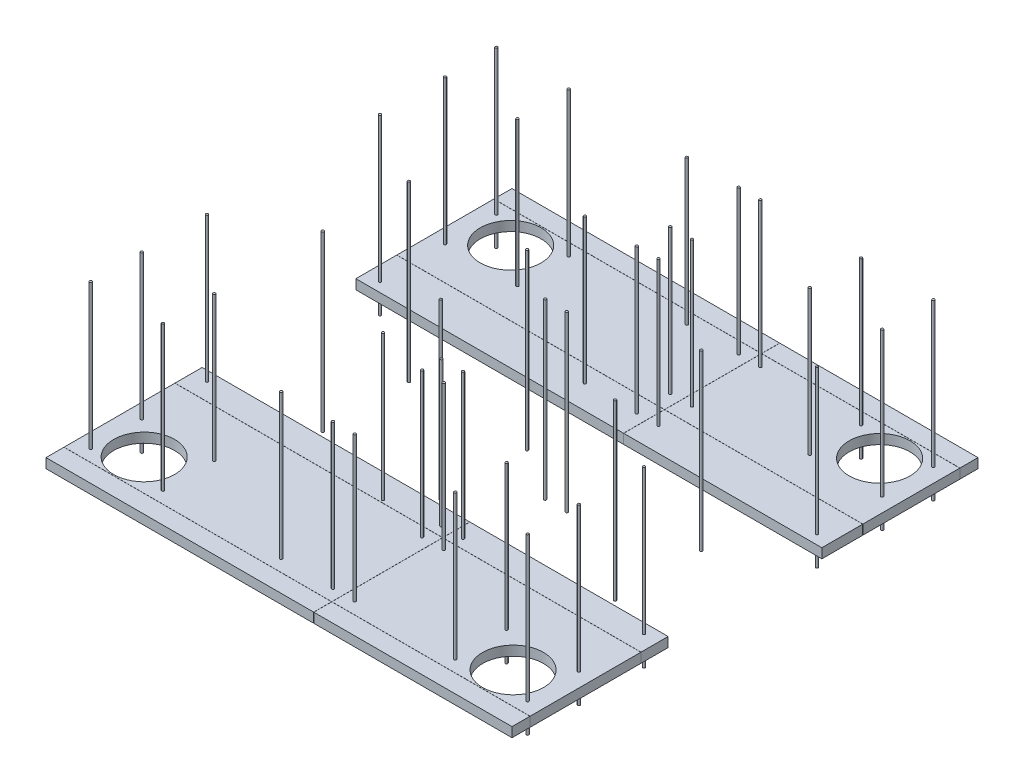
from build123d import *

# Parameters (mm, degrees)
SKETCH1_W                          = 4908.55
SKETCH1_H                          = 4908.55
BOSS_EXTRUDE1_DEPTH                = 101.6
SKETCH2_W                          = 4908.55
SKETCH2_H                          = 1619.25
CUT_EXTRUDE1_DEPTH                 = 3473.355700566
SKETCH4_W                          = 4908.55
SKETCH4_H                          = 1.27
CUT_EXTRUDE_THIN1_DEPTH            = 3473.355700566
CUT_EXTRUDE_THIN2_DEPTH            = 3473.355700566
CUT_EXTRUDE_THIN2_DEPTH_BACK       = 3473.355700566
SKETCH5_W                          = 1.27
SKETCH5_H                          = 4908.55
SKETCH6_R                          = 320.675
DUCT_HOLES_DEPTH                   = 3473.355700566
UNISTRUT_STUD_LAYOUT_DEPTH         = 1524
UNISTRUT_STUD_LAYOUT_DEPTH_BACK    = 304.8
SKETCH7_R                          = 12.7
UNISTRUT_STUD_LAYOUT_2_DEPTH       = 1524
UNISTRUT_STUD_LAYOUT_2_DEPTH_BACK  = 304.8
UNISTRUT_STUD_LAYOUT_3_DEPTH       = 1524
UNISTRUT_STUD_LAYOUT_3_DEPTH_BACK  = 304.8
UNISTRUT_STUD_LAYOUT_4_DEPTH       = 1524
UNISTRUT_STUD_LAYOUT_4_DEPTH_BACK  = 304.8
UNISTRUT_STUD_LAYOUT_5_DEPTH       = 1524
UNISTRUT_STUD_LAYOUT_5_DEPTH_BACK  = 304.8
UNISTRUT_STUD_LAYOUT_6_DEPTH       = 1524
UNISTRUT_STUD_LAYOUT_6_DEPTH_BACK  = 304.8
UNISTRUT_STUD_LAYOUT_7_DEPTH       = 1524
UNISTRUT_STUD_LAYOUT_7_DEPTH_BACK  = 304.8
UNISTRUT_STUD_LAYOUT_8_DEPTH       = 1524
UNISTRUT_STUD_LAYOUT_8_DEPTH_BACK  = 304.8
UNISTRUT_STUD_LAYOUT_9_DEPTH       = 1524
UNISTRUT_STUD_LAYOUT_9_DEPTH_BACK  = 304.8
UNISTRUT_STUD_LAYOUT_10_DEPTH      = 1524
UNISTRUT_STUD_LAYOUT_10_DEPTH_BACK = 304.8
UNISTRUT_STUD_LAYOUT_11_DEPTH      = 1524
UNISTRUT_STUD_LAYOUT_11_DEPTH_BACK = 304.8
UNISTRUT_STUD_LAYOUT_12_DEPTH      = 1524
UNISTRUT_STUD_LAYOUT_12_DEPTH_BACK = 304.8
UNISTRUT_STUD_LAYOUT_13_DEPTH      = 1524
UNISTRUT_STUD_LAYOUT_13_DEPTH_BACK = 304.8
UNISTRUT_STUD_LAYOUT_14_DEPTH      = 1524
UNISTRUT_STUD_LAYOUT_14_DEPTH_BACK = 304.8
UNISTRUT_STUD_LAYOUT_15_DEPTH      = 1524
UNISTRUT_STUD_LAYOUT_15_DEPTH_BACK = 304.8
UNISTRUT_STUD_LAYOUT_16_DEPTH      = 1524
UNISTRUT_STUD_LAYOUT_16_DEPTH_BACK = 304.8
UNISTRUT_STUD_LAYOUT_17_DEPTH      = 1524
UNISTRUT_STUD_LAYOUT_17_DEPTH_BACK = 304.8
UNISTRUT_STUD_LAYOUT_18_DEPTH      = 1524
UNISTRUT_STUD_LAYOUT_18_DEPTH_BACK = 304.8
UNISTRUT_STUD_LAYOUT_19_DEPTH      = 1524
UNISTRUT_STUD_LAYOUT_19_DEPTH_BACK = 304.8
UNISTRUT_STUD_LAYOUT_20_DEPTH      = 1524
UNISTRUT_STUD_LAYOUT_20_DEPTH_BACK = 304.8
UNISTRUT_STUD_LAYOUT_21_DEPTH      = 1524
UNISTRUT_STUD_LAYOUT_21_DEPTH_BACK = 304.8
UNISTRUT_STUD_LAYOUT_22_DEPTH      = 1524
UNISTRUT_STUD_LAYOUT_22_DEPTH_BACK = 304.8
UNISTRUT_STUD_LAYOUT_23_DEPTH      = 1524
UNISTRUT_STUD_LAYOUT_23_DEPTH_BACK = 304.8
UNISTRUT_STUD_LAYOUT_24_DEPTH      = 1524
UNISTRUT_STUD_LAYOUT_24_DEPTH_BACK = 304.8
UNISTRUT_STUD_LAYOUT_25_DEPTH      = 1524
UNISTRUT_STUD_LAYOUT_25_DEPTH_BACK = 304.8
UNISTRUT_STUD_LAYOUT_26_DEPTH      = 1524
UNISTRUT_STUD_LAYOUT_26_DEPTH_BACK = 304.8
UNISTRUT_STUD_LAYOUT_27_DEPTH      = 1524
UNISTRUT_STUD_LAYOUT_27_DEPTH_BACK = 304.8


with BuildPart() as part:
    # Sketch1 → Boss-Extrude1 (new body)
    with BuildSketch(Plane(origin=(0, 0, 0), x_dir=(1, 0, 0), z_dir=(0, 1, 0))):
        Rectangle(SKETCH1_W, SKETCH1_H)
    extrude(amount=BOSS_EXTRUDE1_DEPTH)

    # Sketch2 → Cut-Extrude1 (cut, through all)
    with BuildSketch(Plane(origin=(0, 101.6, 0), x_dir=(1, 0, 0), z_dir=(0, 1, 0))):
        Rectangle(SKETCH2_W, SKETCH2_H)
    extrude(amount=-CUT_EXTRUDE1_DEPTH, mode=Mode.SUBTRACT)


with BuildPart() as cut_extrude1_piece_1:
    # of the separate pieces the step leaves, piece 1, a body of its own (cut_extrude1_pieces)
    add(part.part.solids().sort_by_distance((-2454.275, 0, -2454.275))[0])


with BuildPart() as cut_extrude1_piece_2:
    # of the separate pieces the step leaves, piece 2, a body of its own (cut_extrude1_pieces)
    add(part.part.solids().sort_by_distance((-2454.275, 0, 2454.275))[0])


with BuildPart() as cut_extrude_thin1_tool:
    # Sketch4 → Cut-Extrude-Thin1 (new, through all)
    with BuildSketch(Plane(origin=(0, 101.6, 0), x_dir=(1, 0, 0), z_dir=(0, 1, 0))):
        with Locations((0, -2264.41)):
            Rectangle(SKETCH4_W, SKETCH4_H)
        with Locations((0, -1096.01)):
            Rectangle(SKETCH4_W, SKETCH4_H)
        with Locations((0, 2263.14)):
            Rectangle(SKETCH4_W, SKETCH4_H)
        with Locations((0, 1240.79)):
            Rectangle(SKETCH4_W, SKETCH4_H)
    extrude(amount=-CUT_EXTRUDE_THIN1_DEPTH)


with BuildPart() as cut_extrude1_piece_1_1:
    add(cut_extrude1_piece_1.part)

    # Cut-Extrude-Thin1: cut by cut_extrude_thin1_tool
    add(cut_extrude_thin1_tool.part, mode=Mode.SUBTRACT)


with BuildPart() as cut_extrude1_piece_2_1:
    add(cut_extrude1_piece_2.part)

    # Cut-Extrude-Thin1: cut by cut_extrude_thin1_tool
    add(cut_extrude_thin1_tool.part, mode=Mode.SUBTRACT)


with BuildPart() as cut_extrude_thin1_piece_1:
    # of the separate pieces the step leaves, piece 1, a body of its own (cut_extrude_thin1_pieces)
    add(cut_extrude1_piece_1_1.part.solids().sort_by_distance((-2454.275, 0, -1241.425))[0])


with BuildPart() as cut_extrude_thin1_piece_2:
    # of the separate pieces the step leaves, piece 2, a body of its own (cut_extrude_thin1_pieces)
    add(cut_extrude1_piece_1_1.part.solids().sort_by_distance((-2454.275, 0, -809.625))[0])


with BuildPart() as cut_extrude_thin1_piece_3:
    # of the separate pieces the step leaves, piece 3, a body of its own (cut_extrude_thin1_pieces)
    add(cut_extrude1_piece_1_1.part.solids().sort_by_distance((-2454.275, 0, -2454.275))[0])


with BuildPart() as cut_extrude_thin1_piece_1_of_cut_extrude:
    # of the separate pieces the step leaves, piece 1, a body of its own (cut_extrude_thin1_pieces_of_cut_extrude1)
    add(cut_extrude1_piece_2_1.part.solids().sort_by_distance((-2454.275, 0, 2263.775))[0])


with BuildPart() as cut_extrude_thin1_piece_2_of_cut_extrude:
    # of the separate pieces the step leaves, piece 2, a body of its own (cut_extrude_thin1_pieces_of_cut_extrude1)
    add(cut_extrude1_piece_2_1.part.solids().sort_by_distance((-2454.275, 0, 1095.375))[0])


with BuildPart() as cut_extrude_thin1_piece_3_of_cut_extrude:
    # of the separate pieces the step leaves, piece 3, a body of its own (cut_extrude_thin1_pieces_of_cut_extrude1)
    add(cut_extrude1_piece_2_1.part.solids().sort_by_distance((-2454.275, 0, 2454.275))[0])


with BuildPart() as cut_extrude_thin2_tool:
    # Sketch5 → Cut-Extrude-Thin2 (new, two sides: drawn at the far end of the back side and taken through both)
    with BuildSketch(Plane(origin=(0, 101.6, 0), x_dir=(1, 0, 0), z_dir=(0, 1, 0)).offset(-CUT_EXTRUDE_THIN2_DEPTH_BACK)):
        with Locations((365.76, 0)):
            Rectangle(SKETCH5_W, SKETCH5_H)
    extrude(amount=CUT_EXTRUDE_THIN2_DEPTH + CUT_EXTRUDE_THIN2_DEPTH_BACK)


with BuildPart() as cut_extrude_thin1_piece_1_1:
    add(cut_extrude_thin1_piece_1.part)

    # Cut-Extrude-Thin2: cut by cut_extrude_thin2_tool
    add(cut_extrude_thin2_tool.part, mode=Mode.SUBTRACT)


with BuildPart() as cut_extrude_thin1_piece_2_1:
    add(cut_extrude_thin1_piece_2.part)

    # Cut-Extrude-Thin2: cut by cut_extrude_thin2_tool
    add(cut_extrude_thin2_tool.part, mode=Mode.SUBTRACT)


with BuildPart() as cut_extrude_thin1_piece_3_1:
    add(cut_extrude_thin1_piece_3.part)

    # Cut-Extrude-Thin2: cut by cut_extrude_thin2_tool
    add(cut_extrude_thin2_tool.part, mode=Mode.SUBTRACT)


with BuildPart() as cut_extrude_thin1_piece_1_of_cut_extrude_1:
    add(cut_extrude_thin1_piece_1_of_cut_extrude.part)

    # Cut-Extrude-Thin2: cut by cut_extrude_thin2_tool
    add(cut_extrude_thin2_tool.part, mode=Mode.SUBTRACT)


with BuildPart() as cut_extrude_thin1_piece_2_of_cut_extrude_1:
    add(cut_extrude_thin1_piece_2_of_cut_extrude.part)

    # Cut-Extrude-Thin2: cut by cut_extrude_thin2_tool
    add(cut_extrude_thin2_tool.part, mode=Mode.SUBTRACT)


with BuildPart() as cut_extrude_thin1_piece_3_of_cut_extrude_1:
    add(cut_extrude_thin1_piece_3_of_cut_extrude.part)

    # Cut-Extrude-Thin2: cut by cut_extrude_thin2_tool
    add(cut_extrude_thin2_tool.part, mode=Mode.SUBTRACT)


with BuildPart() as cut_extrude_thin2_piece_1:
    # of the separate pieces the step leaves, piece 1, a body of its own (cut_extrude_thin2_pieces)
    add(cut_extrude_thin1_piece_1_1.part.solids().sort_by_distance((-2454.275, 0, -1241.425))[0])


with BuildPart() as cut_extrude_thin2_piece_2:
    # of the separate pieces the step leaves, piece 2, a body of its own (cut_extrude_thin2_pieces)
    add(cut_extrude_thin1_piece_1_1.part.solids().sort_by_distance((2454.275, 0, -2262.505))[0])


with BuildPart() as cut_extrude_thin2_piece_1_of_cut_extrude:
    # of the separate pieces the step leaves, piece 1, a body of its own (cut_extrude_thin2_pieces_of_cut_extrude)
    add(cut_extrude_thin1_piece_2_1.part.solids().sort_by_distance((-2454.275, 0, -809.625))[0])


with BuildPart() as cut_extrude_thin2_piece_2_of_cut_extrude:
    # of the separate pieces the step leaves, piece 2, a body of its own (cut_extrude_thin2_pieces_of_cut_extrude)
    add(cut_extrude_thin1_piece_2_1.part.solids().sort_by_distance((2454.275, 0, -1240.155))[0])


with BuildPart() as cut_extrude_thin2_piece_1_of_cut_ext_2:
    # of the separate pieces the step leaves, piece 1, a body of its own (cut_extrude_thin2_pieces_of_cut_extr_2)
    add(cut_extrude_thin1_piece_3_1.part.solids().sort_by_distance((-2454.275, 0, -2454.275))[0])


with BuildPart() as cut_extrude_thin2_piece_2_of_cut_ext_2:
    # of the separate pieces the step leaves, piece 2, a body of its own (cut_extrude_thin2_pieces_of_cut_extr_2)
    add(cut_extrude_thin1_piece_3_1.part.solids().sort_by_distance((366.395, 0, -2454.275))[0])


with BuildPart() as cut_extrude_thin2_piece_1_of_cut_ext_3:
    # of the separate pieces the step leaves, piece 1, a body of its own (cut_extrude_thin2_pieces_of_cut_extr_3)
    add(cut_extrude_thin1_piece_1_of_cut_extrude_1.part.solids().sort_by_distance((-2454.275, 0, 2263.775))[0])


with BuildPart() as cut_extrude_thin2_piece_2_of_cut_ext_3:
    # of the separate pieces the step leaves, piece 2, a body of its own (cut_extrude_thin2_pieces_of_cut_extr_3)
    add(cut_extrude_thin1_piece_1_of_cut_extrude_1.part.solids().sort_by_distance((2454.275, 0, 1096.645))[0])


with BuildPart() as cut_extrude_thin2_piece_1_of_cut_ext_4:
    # of the separate pieces the step leaves, piece 1, a body of its own (cut_extrude_thin2_pieces_of_cut_extr_4)
    add(cut_extrude_thin1_piece_2_of_cut_extrude_1.part.solids().sort_by_distance((-2454.275, 0, 1095.375))[0])


with BuildPart() as cut_extrude_thin2_piece_2_of_cut_ext_4:
    # of the separate pieces the step leaves, piece 2, a body of its own (cut_extrude_thin2_pieces_of_cut_extr_4)
    add(cut_extrude_thin1_piece_2_of_cut_extrude_1.part.solids().sort_by_distance((2454.275, 0, 809.625))[0])


with BuildPart() as cut_extrude_thin2_piece_1_of_cut_ext_5:
    # of the separate pieces the step leaves, piece 1, a body of its own (cut_extrude_thin2_pieces_of_cut_extr_5)
    add(cut_extrude_thin1_piece_3_of_cut_extrude_1.part.solids().sort_by_distance((-2454.275, 0, 2454.275))[0])


with BuildPart() as cut_extrude_thin2_piece_2_of_cut_ext_5:
    # of the separate pieces the step leaves, piece 2, a body of its own (cut_extrude_thin2_pieces_of_cut_extr_5)
    add(cut_extrude_thin1_piece_3_of_cut_extrude_1.part.solids().sort_by_distance((2454.275, 0, 2265.045))[0])


with BuildPart() as duct_holes_tool:
    # Sketch6 → DUCT HOLES (new, through all)
    with BuildSketch(Plane(origin=(0, 101.6, 0), x_dir=(1, 0, 0), z_dir=(0, 1, 0))):
        with Locations((1943.1, 1929.13)):
            Circle(SKETCH6_R)
        with Locations((-1943.1, 1929.13)):
            Circle(SKETCH6_R)
        with Locations((-1943.1, -1931.67)):
            Circle(SKETCH6_R)
        with Locations((1943.1, -1931.67)):
            Circle(SKETCH6_R)
    extrude(amount=-DUCT_HOLES_DEPTH)


with BuildPart() as cut_extrude_thin2_piece_1_1:
    add(cut_extrude_thin2_piece_1.part)

    # DUCT HOLES: cut by duct_holes_tool
    add(duct_holes_tool.part, mode=Mode.SUBTRACT)


with BuildPart() as cut_extrude_thin2_piece_2_1:
    add(cut_extrude_thin2_piece_2.part)

    # DUCT HOLES: cut by duct_holes_tool
    add(duct_holes_tool.part, mode=Mode.SUBTRACT)


with BuildPart() as cut_extrude_thin2_piece_1_of_cut_ext_3_1:
    add(cut_extrude_thin2_piece_1_of_cut_ext_3.part)

    # DUCT HOLES: cut by duct_holes_tool
    add(duct_holes_tool.part, mode=Mode.SUBTRACT)


with BuildPart() as cut_extrude_thin2_piece_2_of_cut_ext_3_1:
    add(cut_extrude_thin2_piece_2_of_cut_ext_3.part)

    # DUCT HOLES: cut by duct_holes_tool
    add(duct_holes_tool.part, mode=Mode.SUBTRACT)


with BuildPart() as body_13:
    # Sketch7 → UNISTRUT STUD LAYOUT (new, two sides: drawn at the far end of the back side and taken through both)
    with BuildSketch(Plane(origin=(0, 101.6, 0), x_dir=(1, 0, 0), z_dir=(0, 1, 0)).offset(-UNISTRUT_STUD_LAYOUT_DEPTH_BACK)):
        with Locations((1539.875, 1597.025)):
            Circle(SKETCH7_R)
    extrude(amount=UNISTRUT_STUD_LAYOUT_DEPTH + UNISTRUT_STUD_LAYOUT_DEPTH_BACK)


with BuildPart() as body_14:
    # Sketch7 → UNISTRUT STUD LAYOUT 2 (new, two sides: drawn at the far end of the back side and taken through both)
    with BuildSketch(Plane(origin=(0, 101.6, 0), x_dir=(1, 0, 0), z_dir=(0, 1, 0)).offset(-UNISTRUT_STUD_LAYOUT_2_DEPTH_BACK)):
        with Locations((-1539.875, 1597.025)):
            Circle(SKETCH7_R)
    extrude(amount=UNISTRUT_STUD_LAYOUT_2_DEPTH + UNISTRUT_STUD_LAYOUT_2_DEPTH_BACK)


with BuildPart() as body_15:
    # Sketch7 → UNISTRUT STUD LAYOUT 3 (new, two sides: drawn at the far end of the back side and taken through both)
    with BuildSketch(Plane(origin=(0, 101.6, 0), x_dir=(1, 0, 0), z_dir=(0, 1, 0)).offset(-UNISTRUT_STUD_LAYOUT_3_DEPTH_BACK)):
        with Locations((479.425, 1063.625)):
            Circle(SKETCH7_R)
    extrude(amount=UNISTRUT_STUD_LAYOUT_3_DEPTH + UNISTRUT_STUD_LAYOUT_3_DEPTH_BACK)


with BuildPart() as body_16:
    # Sketch7 → UNISTRUT STUD LAYOUT 4 (new, two sides: drawn at the far end of the back side and taken through both)
    with BuildSketch(Plane(origin=(0, 101.6, 0), x_dir=(1, 0, 0), z_dir=(0, 1, 0)).offset(-UNISTRUT_STUD_LAYOUT_4_DEPTH_BACK)):
        with Locations((-295.275, 2136.775)):
            Circle(SKETCH7_R)
    extrude(amount=UNISTRUT_STUD_LAYOUT_4_DEPTH + UNISTRUT_STUD_LAYOUT_4_DEPTH_BACK)


with BuildPart() as body_17:
    # Sketch7 → UNISTRUT STUD LAYOUT 5 (new, two sides: drawn at the far end of the back side and taken through both)
    with BuildSketch(Plane(origin=(0, 101.6, 0), x_dir=(1, 0, 0), z_dir=(0, 1, 0)).offset(-UNISTRUT_STUD_LAYOUT_5_DEPTH_BACK)):
        with Locations((-1539.875, 2136.775)):
            Circle(SKETCH7_R)
    extrude(amount=UNISTRUT_STUD_LAYOUT_5_DEPTH + UNISTRUT_STUD_LAYOUT_5_DEPTH_BACK)


with BuildPart() as body_18:
    # Sketch7 → UNISTRUT STUD LAYOUT 6 (new, two sides: drawn at the far end of the back side and taken through both)
    with BuildSketch(Plane(origin=(0, 101.6, 0), x_dir=(1, 0, 0), z_dir=(0, 1, 0)).offset(-UNISTRUT_STUD_LAYOUT_6_DEPTH_BACK)):
        with Locations((1539.875, 2136.775)):
            Circle(SKETCH7_R)
    extrude(amount=UNISTRUT_STUD_LAYOUT_6_DEPTH + UNISTRUT_STUD_LAYOUT_6_DEPTH_BACK)


with BuildPart() as body_19:
    # Sketch7 → UNISTRUT STUD LAYOUT 7 (new, two sides: drawn at the far end of the back side and taken through both)
    with BuildSketch(Plane(origin=(0, 101.6, 0), x_dir=(1, 0, 0), z_dir=(0, 1, 0)).offset(-UNISTRUT_STUD_LAYOUT_7_DEPTH_BACK)):
        with Locations((-295.275, 1063.625)):
            Circle(SKETCH7_R)
    extrude(amount=UNISTRUT_STUD_LAYOUT_7_DEPTH + UNISTRUT_STUD_LAYOUT_7_DEPTH_BACK)


with BuildPart() as body_20:
    # Sketch7 → UNISTRUT STUD LAYOUT 8 (new, two sides: drawn at the far end of the back side and taken through both)
    with BuildSketch(Plane(origin=(0, 101.6, 0), x_dir=(1, 0, 0), z_dir=(0, 1, 0)).offset(-UNISTRUT_STUD_LAYOUT_8_DEPTH_BACK)):
        with Locations((-2301.875, 1597.025)):
            Circle(SKETCH7_R)
    extrude(amount=UNISTRUT_STUD_LAYOUT_8_DEPTH + UNISTRUT_STUD_LAYOUT_8_DEPTH_BACK)


with BuildPart() as body_21:
    # Sketch7 → UNISTRUT STUD LAYOUT 9 (new, two sides: drawn at the far end of the back side and taken through both)
    with BuildSketch(Plane(origin=(0, 101.6, 0), x_dir=(1, 0, 0), z_dir=(0, 1, 0)).offset(-UNISTRUT_STUD_LAYOUT_9_DEPTH_BACK)):
        with Locations((2301.875, 1597.025)):
            Circle(SKETCH7_R)
    extrude(amount=UNISTRUT_STUD_LAYOUT_9_DEPTH + UNISTRUT_STUD_LAYOUT_9_DEPTH_BACK)


with BuildPart() as body_22:
    # Sketch7 → UNISTRUT STUD LAYOUT 10 (new, two sides: drawn at the far end of the back side and taken through both)
    with BuildSketch(Plane(origin=(0, 101.6, 0), x_dir=(1, 0, 0), z_dir=(0, 1, 0)).offset(-UNISTRUT_STUD_LAYOUT_10_DEPTH_BACK)):
        with Locations((-2301.875, 2136.775)):
            Circle(SKETCH7_R)
    extrude(amount=UNISTRUT_STUD_LAYOUT_10_DEPTH + UNISTRUT_STUD_LAYOUT_10_DEPTH_BACK)


with BuildPart() as body_23:
    # Sketch7 → UNISTRUT STUD LAYOUT 11 (new, two sides: drawn at the far end of the back side and taken through both)
    with BuildSketch(Plane(origin=(0, 101.6, 0), x_dir=(1, 0, 0), z_dir=(0, 1, 0)).offset(-UNISTRUT_STUD_LAYOUT_11_DEPTH_BACK)):
        with Locations((2301.875, 2136.775)):
            Circle(SKETCH7_R)
    extrude(amount=UNISTRUT_STUD_LAYOUT_11_DEPTH + UNISTRUT_STUD_LAYOUT_11_DEPTH_BACK)


with BuildPart() as body_24:
    # Sketch7 → UNISTRUT STUD LAYOUT 12 (new, two sides: drawn at the far end of the back side and taken through both)
    with BuildSketch(Plane(origin=(0, 101.6, 0), x_dir=(1, 0, 0), z_dir=(0, 1, 0)).offset(-UNISTRUT_STUD_LAYOUT_12_DEPTH_BACK)):
        with Locations((250.825, 1416.685)):
            Circle(SKETCH7_R)
    extrude(amount=UNISTRUT_STUD_LAYOUT_12_DEPTH + UNISTRUT_STUD_LAYOUT_12_DEPTH_BACK)


with BuildPart() as body_25:
    # Sketch7 → UNISTRUT STUD LAYOUT 13 (new, two sides: drawn at the far end of the back side and taken through both)
    with BuildSketch(Plane(origin=(0, 101.6, 0), x_dir=(1, 0, 0), z_dir=(0, 1, 0)).offset(-UNISTRUT_STUD_LAYOUT_13_DEPTH_BACK)):
        with Locations((479.425, 1416.685)):
            Circle(SKETCH7_R)
    extrude(amount=UNISTRUT_STUD_LAYOUT_13_DEPTH + UNISTRUT_STUD_LAYOUT_13_DEPTH_BACK)


with BuildPart() as body_26:
    # Sketch7 → UNISTRUT STUD LAYOUT 14 (new, two sides: drawn at the far end of the back side and taken through both)
    with BuildSketch(Plane(origin=(0, 101.6, 0), x_dir=(1, 0, 0), z_dir=(0, 1, 0)).offset(-UNISTRUT_STUD_LAYOUT_14_DEPTH_BACK)):
        with Locations((250.825, 1063.625)):
            Circle(SKETCH7_R)
    extrude(amount=UNISTRUT_STUD_LAYOUT_14_DEPTH + UNISTRUT_STUD_LAYOUT_14_DEPTH_BACK)


with BuildPart() as body_27:
    # Sketch7 → UNISTRUT STUD LAYOUT 15 (new, two sides: drawn at the far end of the back side and taken through both)
    with BuildSketch(Plane(origin=(0, 101.6, 0), x_dir=(1, 0, 0), z_dir=(0, 1, 0)).offset(-UNISTRUT_STUD_LAYOUT_15_DEPTH_BACK)):
        with Locations((479.425, -995.045)):
            Circle(SKETCH7_R)
    extrude(amount=UNISTRUT_STUD_LAYOUT_15_DEPTH + UNISTRUT_STUD_LAYOUT_15_DEPTH_BACK)


with BuildPart() as body_28:
    # Sketch7 → UNISTRUT STUD LAYOUT 16 (new, two sides: drawn at the far end of the back side and taken through both)
    with BuildSketch(Plane(origin=(0, 101.6, 0), x_dir=(1, 0, 0), z_dir=(0, 1, 0)).offset(-UNISTRUT_STUD_LAYOUT_16_DEPTH_BACK)):
        with Locations((250.825, -995.045)):
            Circle(SKETCH7_R)
    extrude(amount=UNISTRUT_STUD_LAYOUT_16_DEPTH + UNISTRUT_STUD_LAYOUT_16_DEPTH_BACK)


with BuildPart() as body_29:
    # Sketch7 → UNISTRUT STUD LAYOUT 17 (new, two sides: drawn at the far end of the back side and taken through both)
    with BuildSketch(Plane(origin=(0, 101.6, 0), x_dir=(1, 0, 0), z_dir=(0, 1, 0)).offset(-UNISTRUT_STUD_LAYOUT_17_DEPTH_BACK)):
        with Locations((250.825, -1198.245)):
            Circle(SKETCH7_R)
    extrude(amount=UNISTRUT_STUD_LAYOUT_17_DEPTH + UNISTRUT_STUD_LAYOUT_17_DEPTH_BACK)


with BuildPart() as body_30:
    # Sketch7 → UNISTRUT STUD LAYOUT 18 (new, two sides: drawn at the far end of the back side and taken through both)
    with BuildSketch(Plane(origin=(0, 101.6, 0), x_dir=(1, 0, 0), z_dir=(0, 1, 0)).offset(-UNISTRUT_STUD_LAYOUT_18_DEPTH_BACK)):
        with Locations((479.425, -1198.245)):
            Circle(SKETCH7_R)
    extrude(amount=UNISTRUT_STUD_LAYOUT_18_DEPTH + UNISTRUT_STUD_LAYOUT_18_DEPTH_BACK)


with BuildPart() as body_31:
    # Sketch7 → UNISTRUT STUD LAYOUT 19 (new, two sides: drawn at the far end of the back side and taken through both)
    with BuildSketch(Plane(origin=(0, 101.6, 0), x_dir=(1, 0, 0), z_dir=(0, 1, 0)).offset(-UNISTRUT_STUD_LAYOUT_19_DEPTH_BACK)):
        with Locations((-2301.875, 911.225)):
            Circle(SKETCH7_R)
    extrude(amount=UNISTRUT_STUD_LAYOUT_19_DEPTH + UNISTRUT_STUD_LAYOUT_19_DEPTH_BACK)


with BuildPart() as body_32:
    # Sketch7 → UNISTRUT STUD LAYOUT 20 (new, two sides: drawn at the far end of the back side and taken through both)
    with BuildSketch(Plane(origin=(0, 101.6, 0), x_dir=(1, 0, 0), z_dir=(0, 1, 0)).offset(-UNISTRUT_STUD_LAYOUT_20_DEPTH_BACK)):
        with Locations((2301.875, 911.225)):
            Circle(SKETCH7_R)
    extrude(amount=UNISTRUT_STUD_LAYOUT_20_DEPTH + UNISTRUT_STUD_LAYOUT_20_DEPTH_BACK)


with BuildPart() as body_33:
    # Sketch7 → UNISTRUT STUD LAYOUT 21 (new, two sides: drawn at the far end of the back side and taken through both)
    with BuildSketch(Plane(origin=(0, 101.6, 0), x_dir=(1, 0, 0), z_dir=(0, 1, 0)).offset(-UNISTRUT_STUD_LAYOUT_21_DEPTH_BACK)):
        with Locations((1539.875, 454.025)):
            Circle(SKETCH7_R)
    extrude(amount=UNISTRUT_STUD_LAYOUT_21_DEPTH + UNISTRUT_STUD_LAYOUT_21_DEPTH_BACK)


with BuildPart() as body_34:
    # Sketch7 → UNISTRUT STUD LAYOUT 22 (new, two sides: drawn at the far end of the back side and taken through both)
    with BuildSketch(Plane(origin=(0, 101.6, 0), x_dir=(1, 0, 0), z_dir=(0, 1, 0)).offset(-UNISTRUT_STUD_LAYOUT_22_DEPTH_BACK)):
        with Locations((-1539.875, 454.025)):
            Circle(SKETCH7_R)
    extrude(amount=UNISTRUT_STUD_LAYOUT_22_DEPTH + UNISTRUT_STUD_LAYOUT_22_DEPTH_BACK)


with BuildPart() as body_35:
    # Sketch7 → UNISTRUT STUD LAYOUT 23 (new, two sides: drawn at the far end of the back side and taken through both)
    with BuildSketch(Plane(origin=(0, 101.6, 0), x_dir=(1, 0, 0), z_dir=(0, 1, 0)).offset(-UNISTRUT_STUD_LAYOUT_23_DEPTH_BACK)):
        with Locations((-295.275, 454.025)):
            Circle(SKETCH7_R)
    extrude(amount=UNISTRUT_STUD_LAYOUT_23_DEPTH + UNISTRUT_STUD_LAYOUT_23_DEPTH_BACK)


with BuildPart() as body_36:
    # Sketch7 → UNISTRUT STUD LAYOUT 24 (new, two sides: drawn at the far end of the back side and taken through both)
    with BuildSketch(Plane(origin=(0, 101.6, 0), x_dir=(1, 0, 0), z_dir=(0, 1, 0)).offset(-UNISTRUT_STUD_LAYOUT_24_DEPTH_BACK)):
        with Locations((479.425, 98.425)):
            Circle(SKETCH7_R)
    extrude(amount=UNISTRUT_STUD_LAYOUT_24_DEPTH + UNISTRUT_STUD_LAYOUT_24_DEPTH_BACK)


with BuildPart() as body_37:
    # Sketch7 → UNISTRUT STUD LAYOUT 25 (new, two sides: drawn at the far end of the back side and taken through both)
    with BuildSketch(Plane(origin=(0, 101.6, 0), x_dir=(1, 0, 0), z_dir=(0, 1, 0)).offset(-UNISTRUT_STUD_LAYOUT_25_DEPTH_BACK)):
        with Locations((250.825, 98.425)):
            Circle(SKETCH7_R)
    extrude(amount=UNISTRUT_STUD_LAYOUT_25_DEPTH + UNISTRUT_STUD_LAYOUT_25_DEPTH_BACK)


with BuildPart() as body_38:
    # Sketch7 → UNISTRUT STUD LAYOUT 26 (new, two sides: drawn at the far end of the back side and taken through both)
    with BuildSketch(Plane(origin=(0, 101.6, 0), x_dir=(1, 0, 0), z_dir=(0, 1, 0)).offset(-UNISTRUT_STUD_LAYOUT_26_DEPTH_BACK)):
        with Locations((250.825, 2136.775)):
            Circle(SKETCH7_R)
    extrude(amount=UNISTRUT_STUD_LAYOUT_26_DEPTH + UNISTRUT_STUD_LAYOUT_26_DEPTH_BACK)


with BuildPart() as body_39:
    # Sketch7 → UNISTRUT STUD LAYOUT 27 (new, two sides: drawn at the far end of the back side and taken through both)
    with BuildSketch(Plane(origin=(0, 101.6, 0), x_dir=(1, 0, 0), z_dir=(0, 1, 0)).offset(-UNISTRUT_STUD_LAYOUT_27_DEPTH_BACK)):
        with Locations((479.425, 2136.775)):
            Circle(SKETCH7_R)
    extrude(amount=UNISTRUT_STUD_LAYOUT_27_DEPTH + UNISTRUT_STUD_LAYOUT_27_DEPTH_BACK)


with BuildPart() as body_40:
    # Mirror3: mirrored copy
    add(body_20.part.mirror(Plane.XY))


with BuildPart() as body_41:
    # Mirror3 2: mirrored copy
    add(body_14.part.mirror(Plane.XY))


with BuildPart() as body_42:
    # Mirror3 3: mirrored copy
    add(body_17.part.mirror(Plane.XY))


with BuildPart() as body_43:
    # Mirror3 4: mirrored copy
    add(body_19.part.mirror(Plane.XY))


with BuildPart() as body_44:
    # Mirror3 5: mirrored copy
    add(body_16.part.mirror(Plane.XY))


with BuildPart() as body_45:
    # Mirror3 6: mirrored copy
    add(body_13.part.mirror(Plane.XY))


with BuildPart() as body_46:
    # Mirror3 7: mirrored copy
    add(body_18.part.mirror(Plane.XY))


with BuildPart() as body_47:
    # Mirror3 8: mirrored copy
    add(body_21.part.mirror(Plane.XY))


with BuildPart() as body_48:
    # Mirror3 9: mirrored copy
    add(body_22.part.mirror(Plane.XY))


with BuildPart() as body_49:
    # Mirror3 10: mirrored copy
    add(body_23.part.mirror(Plane.XY))


with BuildPart() as body_50:
    # Mirror3 11: mirrored copy
    add(body_32.part.mirror(Plane.XY))


with BuildPart() as body_51:
    # Mirror3 12: mirrored copy
    add(body_31.part.mirror(Plane.XY))


with BuildPart() as body_52:
    # Mirror3 13: mirrored copy
    add(body_34.part.mirror(Plane.XY))


with BuildPart() as body_53:
    # Mirror3 14: mirrored copy
    add(body_35.part.mirror(Plane.XY))


with BuildPart() as body_54:
    # Mirror3 15: mirrored copy
    add(body_33.part.mirror(Plane.XY))


with BuildPart() as body_55:
    # Mirror3 16: mirrored copy
    add(body_38.part.mirror(Plane.XY))


with BuildPart() as body_56:
    # Mirror3 17: mirrored copy
    add(body_39.part.mirror(Plane.XY))


solid = Compound([cut_extrude_thin2_piece_1_of_cut_extrude.part, cut_extrude_thin2_piece_2_of_cut_extrude.part, cut_extrude_thin2_piece_1_of_cut_ext_2.part, cut_extrude_thin2_piece_2_of_cut_ext_2.part, cut_extrude_thin2_piece_1_of_cut_ext_4.part, cut_extrude_thin2_piece_2_of_cut_ext_4.part, cut_extrude_thin2_piece_1_of_cut_ext_5.part, cut_extrude_thin2_piece_2_of_cut_ext_5.part, cut_extrude_thin2_piece_1_1.part, cut_extrude_thin2_piece_2_1.part, cut_extrude_thin2_piece_1_of_cut_ext_3_1.part, cut_extrude_thin2_piece_2_of_cut_ext_3_1.part, body_13.part, body_14.part, body_15.part, body_16.part, body_17.part, body_18.part, body_19.part, body_20.part, body_21.part, body_22.part, body_23.part, body_24.part, body_25.part, body_26.part, body_27.part, body_28.part, body_29.part, body_30.part, body_31.part, body_32.part, body_33.part, body_34.part, body_35.part, body_36.part, body_37.part, body_38.part, body_39.part, body_40.part, body_41.part, body_42.part, body_43.part, body_44.part, body_45.part, body_46.part, body_47.part, body_48.part, body_49.part, body_50.part, body_51.part, body_52.part, body_53.part, body_54.part, body_55.part, body_56.part])
